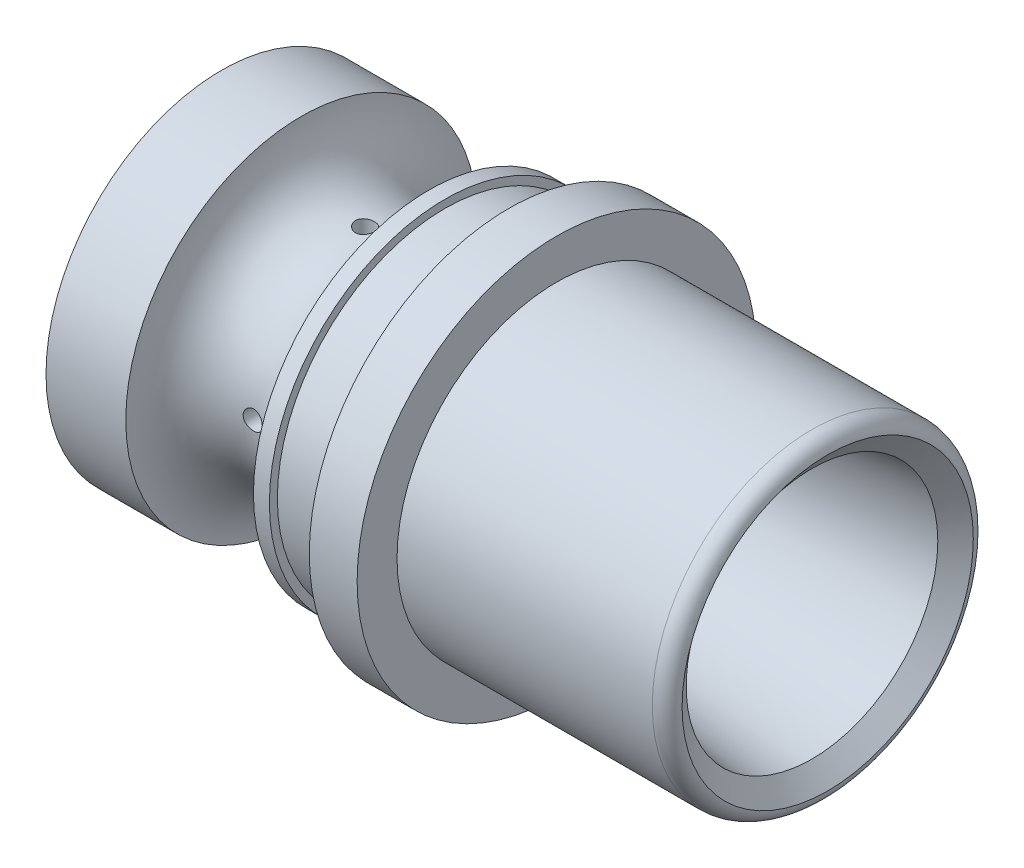
from build123d import *

# Parameters (mm, degrees)
SKETCH_4_R               = 2
SKETCH_5_R               = 0.3
CUT_EXTRUDE_1_DEPTH      = 21.95530959
PATTERN_CIRCULAR_6_COUNT = 2
PATTERN_CIRCULAR_6_ANGLE = 90
FILLET_1_R               = 0.5
CHAMFER_1_SIZE           = 0.5679439
CHAMFER_1_SIZE_2         = 0.5
FILLET_2_R               = 0.5


with BuildPart() as part:
    # Эскиз1 → Повернуть31 (revolve)
    with BuildSketch(Plane.XY, mode=Mode.PRIVATE) as revolve_31_sk:
        Polygon((0, 0), (0, 5.5), (7, 5.5), (7, 5.25), (9, 5.25), (9, 6.25), (10.5, 6.25), (10.5, 5), (19, 5), (19, 0), align=None)
    revolve(revolve_31_sk.sketch.rotate(Axis((-6.646654946, 0, 0), (1, 0, 0)), 90), axis=Axis((-6.646654946, 0, 0), (1, 0, 0)))

    # Эскиз2 → Вырез-Повернуть2 (revolve, cut)
    with BuildSketch(Plane.XY, mode=Mode.PRIVATE) as cut_revolve_2_sk:
        with BuildLine():
            Line((0, 0), (19, 0))
            Line((19, 0), (19, 4))
            Line((19, 4), (6.320642864, 2.555369732))
            Line((6.320642864, 2.555369732), (6, 2))
            Line((6, 2), (4, 2))
            ThreePointArc((4, 2), (2.401923789, 4.035898385), (0, 5))
            Line((0, 5), (0, 0))
        make_face()
    revolve(cut_revolve_2_sk.sketch.rotate(Axis((0, 0, 0), (1, 0, 0)), 90), axis=Axis((0, 0, 0), (1, 0, 0)), mode=Mode.SUBTRACT)

    # Эскиз4 → Вырез-Повернуть3 (revolve, cut)
    with BuildSketch(Plane.XY, mode=Mode.PRIVATE) as cut_revolve_3_sk:
        with Locations((4.5, 5.5)):
            Circle(SKETCH_4_R)
    revolve(cut_revolve_3_sk.sketch.rotate(Axis((0, 0, 0), (1, 0, 0)), 90), axis=Axis((0, 0, 0), (1, 0, 0)), mode=Mode.SUBTRACT)

    # Эскиз5 → Вырез-Вытянуть1 (cut, symmetric)
    with BuildSketch(Plane.XY):
        with Locations(Location((4.5, 0, 0), (0, 0, 180))):
            Circle(SKETCH_5_R)
    cut_extrude_1 = extrude(amount=CUT_EXTRUDE_1_DEPTH, both=True, mode=Mode.SUBTRACT)

    # Круговой массив6: Вырез-Вытянуть1 ×2 about axis
    pattern_circular_6_axis = Axis((-6.646654946, 0, 0), (-1, 0, 0))
    for i in range(1, PATTERN_CIRCULAR_6_COUNT):
        add(cut_extrude_1.rotate(pattern_circular_6_axis, i * PATTERN_CIRCULAR_6_ANGLE / (PATTERN_CIRCULAR_6_COUNT - 1)), mode=Mode.SUBTRACT)

    # Скругление1
    fillet_1_edges = [part.edges().sort_by_distance(p)[0] for p in [
        (19, 0, -5),
    ]]
    fillet(fillet_1_edges, radius=FILLET_1_R)

    # Фаска1
    # the kernel refuses this chamfer: 0.5679439, 0.5 mm, written as the material it takes off along each edge
    with BuildSketch(Plane(origin=(19, 0, 0), x_dir=(0, 0, 1), z_dir=(0, 1, 0))) as chamfer_1_piece_1:
        Polygon((4 + CHAMFER_1_SIZE, 0), (4 - CHAMFER_1_SIZE_2 * 0.113203213768, -CHAMFER_1_SIZE_2 * 0.993571855677), (4, 0), align=None)
    revolve(axis=Axis((19, 0, 0), (1, 0, 0)), mode=Mode.SUBTRACT)

    # Скругление2
    fillet_2_edges = [part.edges().sort_by_distance(p)[0] for p in [
        (6.320642864, 0, -2.555369732),
    ]]
    fillet(fillet_2_edges, radius=FILLET_2_R)


solid = part.part
